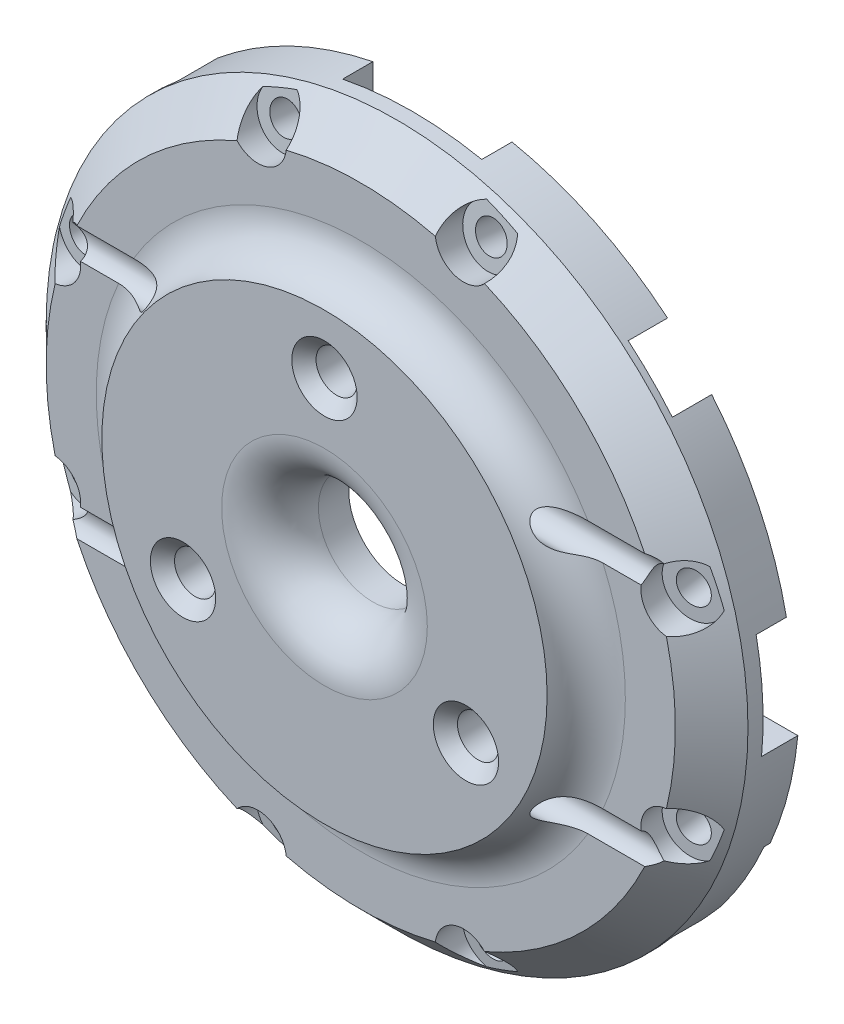
from build123d import *

# Parameters (mm, degrees)
SKETCH1_R               = 29
BOSS_EXTRUDE1_DEPTH     = 6.75
SKETCH3_W               = 44.5
SKETCH3_H               = 44.5
CUT_EXTRUDE1_DEPTH      = 3.25
SKETCH4_R               = 18.4
BOSS_EXTRUDE2_DEPTH     = 3
FILLET1_R               = 3.5
SKETCH5_R               = 1.7
CUT_EXTRUDE2_DEPTH      = 43.155219131
SKETCH7_R               = 3.25
CUT_EXTRUDE3_DEPTH      = 2
CHAMFER2_SIZE           = 3
CUT_EXTRUDE5_DEPTH      = 43.155219131
CUT_EXTRUDE5_DEPTH_BACK = 43.155219131
SKETCH9_R               = 1.3
SKETCH10_W              = 11.5
SKETCH10_H              = 12.03351403
SKETCH10_W_2            = 12.03351403
SKETCH10_H_2            = 11.5
CUT_EXTRUDE6_DEPTH      = 2.5
SKETCH13_W              = 6.5
SKETCH13_H              = 6.5
CUT_EXTRUDE9_DEPTH      = 2.25
SKETCH14_W              = 15.887507813
SKETCH14_H              = 11.6
CUT_EXTRUDE10_DEPTH     = 2.5
FILLET2_R               = 1.5
BOSS_EXTRUDE3_START     = 3
BOSS_EXTRUDE3_DEPTH     = 3
CHAMFER7_SIZE           = 1.25
SKETCH16_R              = 4.5
CUT_EXTRUDE11_DEPTH     = 43.27366215
FILLET3_R               = 4
CHAMFER6_SIZE           = 1
SKETCH17_R              = 1.3
CUT_EXTRUDE12_DEPTH     = 43.155219292
CUT_EXTRUDE13_START     = 20
SKETCH18_R              = 2.35
CUT_EXTRUDE13_DEPTH     = 12.5
CIRPATTERN1_COUNT       = 4


with BuildPart() as part:
    # Sketch1 → Boss-Extrude1 (new body)
    with BuildSketch(Plane.XY):
        Circle(SKETCH1_R)
    extrude(amount=BOSS_EXTRUDE1_DEPTH)

    # Sketch3 → Cut-Extrude1 (cut)
    with BuildSketch(Plane(origin=(0, 0, 0), x_dir=(-1, 0, 0), z_dir=(0, 0, -1))):
        Rectangle(SKETCH3_W, SKETCH3_H)
    extrude(amount=-CUT_EXTRUDE1_DEPTH, mode=Mode.SUBTRACT)

    # Sketch4 → Boss-Extrude2 (add)
    with BuildSketch(Plane.XY.offset(6.75)):
        Circle(SKETCH4_R)
    extrude(amount=BOSS_EXTRUDE2_DEPTH)

    # Fillet1
    # the kernel refuses this fillet: 3.5 mm, written as the material it adds along each edge
    with BuildSketch(Plane(origin=(0, 0, 6.75), x_dir=(1, 0, 0), z_dir=(0, -1, 0))) as fillet1_piece_1:
        with BuildLine():
            CenterArc((21.864101615, 3.5), FILLET1_R, 188.213210702, 81.786789298)
            Line((18.4, 3), (18.330717968, 2.99))
            ThreePointArc((18.330717968, 2.99), (18.33, 1.5), (18.33, 0))
            Line((18.33, 0), (18.4, -0.07))
            Line((18.4, -0.07), (21.864101615, -0.07))
            Line((21.864101615, -0.07), (21.864101615, 0))
        make_face()
    revolve(axis=Axis((0, 0, 6.75), (0, 0, 1)))

    # Sketch5 → Cut-Extrude2 (cut, through all)
    with BuildSketch(Plane.XY.offset(9.75)):
        with Locations((0, 13.5)):
            Circle(SKETCH5_R)
        with Locations((11.691342951, -6.75)):
            Circle(SKETCH5_R)
        with Locations((-11.691342951, -6.75)):
            Circle(SKETCH5_R)
    extrude(amount=-CUT_EXTRUDE2_DEPTH, mode=Mode.SUBTRACT)

    # Sketch7 → Cut-Extrude3 (cut)
    with BuildSketch(Plane(origin=(0, 0, 3.25), x_dir=(-1, 0, 0), z_dir=(0, 0, -1))):
        with Locations((-11.691342951, -6.75)):
            Circle(SKETCH7_R)
        with Locations((11.691342951, -6.75)):
            Circle(SKETCH7_R)
        with Locations((0, 13.5)):
            Circle(SKETCH7_R)
    extrude(amount=-CUT_EXTRUDE3_DEPTH, mode=Mode.SUBTRACT)

    # Chamfer2
    chamfer2_edges = [part.edges().sort_by_distance(p)[0] for p in [
        (-29, 0, 6.75),
    ]]
    chamfer(chamfer2_edges, length=CHAMFER2_SIZE)

    # Sketch9 → Cut-Extrude5 (cut, two sides: drawn at the far end of the back side and taken through both)
    with BuildSketch(Plane(origin=(0, 0, 0), x_dir=(0, 0, -1), z_dir=(1, 0, 0)).offset(-CUT_EXTRUDE5_DEPTH_BACK)):
        with Locations(Location((-7.25, 10, 0), (0, 0, 292.619864948))):
            Circle(SKETCH9_R)
        with Locations(Location((-7.25, -10, 0), (0, 0, 292.619864948))):
            Circle(SKETCH9_R)
    extrude(amount=CUT_EXTRUDE5_DEPTH + CUT_EXTRUDE5_DEPTH_BACK, mode=Mode.SUBTRACT)

    # Sketch10 → Cut-Extrude6 (cut)
    with BuildSketch(Plane(origin=(0, 0, 0), x_dir=(-1, 0, 0), z_dir=(0, 0, -1))):
        with Locations((0, -28.01742408)):
            Rectangle(SKETCH10_W, SKETCH10_H)
        with Locations((28.01742408, 0)):
            Rectangle(SKETCH10_W_2, SKETCH10_H_2)
        with Locations((-28.01742408, 0)):
            Rectangle(SKETCH10_W_2, SKETCH10_H_2)
        with Locations((0, 28.01742408)):
            Rectangle(SKETCH10_W, SKETCH10_H)
    extrude(amount=-CUT_EXTRUDE6_DEPTH, mode=Mode.SUBTRACT)

    # Sketch13 → Cut-Extrude9 (cut)
    with BuildSketch(Plane(origin=(0, 0, 3.25), x_dir=(-1, 0, 0), z_dir=(0, 0, -1))):
        with Locations((-18.9, 11.5)):
            Rectangle(SKETCH13_W, SKETCH13_H)
        with Locations((11.5, 18.9)):
            Rectangle(SKETCH13_W, SKETCH13_H)
        with Locations((18.9, -11.5)):
            Rectangle(SKETCH13_W, SKETCH13_H)
        with Locations((-11.5, -18.9)):
            Rectangle(SKETCH13_W, SKETCH13_H)
    extrude(amount=-CUT_EXTRUDE9_DEPTH, mode=Mode.SUBTRACT)

    # Chamfer5
    # the kernel refuses this chamfer: 1 mm, written as the material it takes off along each edge
    with BuildSketch(Plane(origin=(15.65, 8.25, 3.25), x_dir=(0, -0.9996219169112968, -0.027495876610586487), z_dir=(1, 0, 0)), Plane(origin=(15.65, 14.75, 3.25), x_dir=(-0.9996219169112968, 0, -0.02749587661058651), z_dir=(0, -1, 0)), Plane(origin=(22.15, 14.75, 3.25), x_dir=(0, 0.9996219169112968, -0.02749587661058651), z_dir=(-1, 0, 0)), Plane(origin=(-8.25, 15.65, 3.25), x_dir=(0.9996219169112968, 0, -0.027495876610586487), z_dir=(0, 1, 0)), Plane(origin=(-14.75, 15.65, 3.25), x_dir=(0, -0.9996219169112968, -0.02749587661058651), z_dir=(1, 0, 0)), Plane(origin=(-14.75, 22.15, 3.25), x_dir=(-0.9996219169112968, 0, -0.02749587661058651), z_dir=(0, -1, 0)), Plane(origin=(-15.65, -8.25, 3.25), x_dir=(0, 0.9996219169112968, -0.027495876610586487), z_dir=(-1, 0, 0)), Plane(origin=(-15.65, -14.75, 3.25), x_dir=(0.9996219169112968, 0, -0.02749587661058651), z_dir=(0, 1, 0)), Plane(origin=(-22.15, -14.75, 3.25), x_dir=(0, -0.9996219169112968, -0.02749587661058651), z_dir=(1, 0, 0)), Plane(origin=(8.25, -15.65, 3.25), x_dir=(-0.9996219169112968, 0, -0.027495876610586487), z_dir=(0, -1, 0)), Plane(origin=(14.75, -15.65, 3.25), x_dir=(0, 0.9996219169112968, -0.02749587661058651), z_dir=(-1, 0, 0)), Plane(origin=(14.75, -22.15, 3.25), x_dir=(0.9996219169112968, 0, -0.02749587661058651), z_dir=(0, 1, 0))) as chamfer5_piece_1:
        with BuildLine():
            Line((1.028673195, 0), (-0.056547155, -1.027117794))
            Line((-0.056547155, -1.027117794), (-0.076539593, -1.026567876))
            ThreePointArc((-0.076539593, -1.026567876), (-0.034129227, -0.51339783), (-0.019992438, 0.000549918))
            Line((-0.019992438, 0.000549918), (0.000549918, 0.019992438))
            ThreePointArc((0.000549918, 0.019992438), (0.514497665, 0.00585565), (1.029223113, 0.019992438))
            Line((1.029223113, 0.019992438), (1.028673195, 0))
        make_face()
    extrude(amount=6.5, mode=Mode.SUBTRACT)
    with BuildSketch(Plane(origin=(13.078317012, 8.25, 3.25), x_dir=(0, -0.9996219169112968, -0.027495876610586487), z_dir=(1, 0, 0))) as chamfer5_piece_2a_section:
        with BuildLine():
            Line((1.028673195, 0), (-0.056547155, -1.027117794))
            Line((-0.056547155, -1.027117794), (-0.076539593, -1.026567876))
            ThreePointArc((-0.076539593, -1.026567876), (-0.034129227, -0.51339783), (-0.019992438, 0.000549918))
            Line((-0.019992438, 0.000549918), (0.000549918, 0.019992438))
            ThreePointArc((0.000549918, 0.019992438), (0.514497665, 0.00585565), (1.029223113, 0.019992438))
            Line((1.029223113, 0.019992438), (1.028673195, 0))
        make_face()
    chamfer5_piece_2a = extrude(amount=9.071682988, mode=Mode.PRIVATE)
    chamfer5_piece_2a = split(chamfer5_piece_2a, bisect_by=Plane(origin=(15.65, 7.920206373, 3.579793627), z_dir=(-1, 0, 0)), keep=Keep.TOP, mode=Mode.PRIVATE)
    with BuildSketch(Plane(origin=(15.65, 14.75, 3.25), x_dir=(-0.9996219169112968, 0, -0.02749587661058651), z_dir=(0, -1, 0))) as chamfer5_piece_2b_section:
        with BuildLine():
            Line((1.028673195, 0), (-0.056547155, -1.027117794))
            Line((-0.056547155, -1.027117794), (-0.076539593, -1.026567876))
            ThreePointArc((-0.076539593, -1.026567876), (-0.034129227, -0.51339783), (-0.019992438, 0.000549918))
            Line((-0.019992438, 0.000549918), (0.000549918, 0.019992438))
            ThreePointArc((0.000549918, 0.019992438), (0.514497665, 0.00585565), (1.029223113, 0.019992438))
            Line((1.029223113, 0.019992438), (1.028673195, 0))
        make_face()
    chamfer5_piece_2b = extrude(amount=9.071682988, mode=Mode.PRIVATE)
    chamfer5_piece_2b = split(chamfer5_piece_2b, bisect_by=Plane(origin=(15.320206373, 8.25, 3.579793627), z_dir=(0, -1, 0)), keep=Keep.TOP, mode=Mode.PRIVATE)
    chamfer5_piece_2 = chamfer5_piece_2a & chamfer5_piece_2b
    add(chamfer5_piece_2, mode=Mode.SUBTRACT)
    with BuildSketch(Plane(origin=(15.65, 17.321682988, 3.25), x_dir=(-0.9996219169112968, 0, -0.02749587661058651), z_dir=(0, -1, 0))) as chamfer5_piece_3a_section:
        with BuildLine():
            Line((1.028673195, 0), (-0.056547155, -1.027117794))
            Line((-0.056547155, -1.027117794), (-0.076539593, -1.026567876))
            ThreePointArc((-0.076539593, -1.026567876), (-0.034129227, -0.51339783), (-0.019992438, 0.000549918))
            Line((-0.019992438, 0.000549918), (0.000549918, 0.019992438))
            ThreePointArc((0.000549918, 0.019992438), (0.514497665, 0.00585565), (1.029223113, 0.019992438))
            Line((1.029223113, 0.019992438), (1.028673195, 0))
        make_face()
    chamfer5_piece_3a = extrude(amount=9.071682988, mode=Mode.PRIVATE)
    chamfer5_piece_3a = split(chamfer5_piece_3a, bisect_by=Plane(origin=(15.320206373, 14.75, 3.579793627), z_dir=(0, 1, 0)), keep=Keep.TOP, mode=Mode.PRIVATE)
    with BuildSketch(Plane(origin=(22.15, 14.75, 3.25), x_dir=(0, 0.9996219169112968, -0.02749587661058651), z_dir=(-1, 0, 0))) as chamfer5_piece_3b_section:
        with BuildLine():
            Line((1.028673195, 0), (-0.056547155, -1.027117794))
            Line((-0.056547155, -1.027117794), (-0.076539593, -1.026567876))
            ThreePointArc((-0.076539593, -1.026567876), (-0.034129227, -0.51339783), (-0.019992438, 0.000549918))
            Line((-0.019992438, 0.000549918), (0.000549918, 0.019992438))
            ThreePointArc((0.000549918, 0.019992438), (0.514497665, 0.00585565), (1.029223113, 0.019992438))
            Line((1.029223113, 0.019992438), (1.028673195, 0))
        make_face()
    chamfer5_piece_3b = extrude(amount=9.071682988, mode=Mode.PRIVATE)
    chamfer5_piece_3b = split(chamfer5_piece_3b, bisect_by=Plane(origin=(15.65, 15.079793627, 3.579793627), z_dir=(-1, 0, 0)), keep=Keep.TOP, mode=Mode.PRIVATE)
    chamfer5_piece_3 = chamfer5_piece_3a & chamfer5_piece_3b
    add(chamfer5_piece_3, mode=Mode.SUBTRACT)
    with BuildSketch(Plane(origin=(-8.25, 13.078317012, 3.25), x_dir=(0.9996219169112968, 0, -0.027495876610586487), z_dir=(0, 1, 0))) as chamfer5_piece_4a_section:
        with BuildLine():
            Line((1.028673195, 0), (-0.056547155, -1.027117794))
            Line((-0.056547155, -1.027117794), (-0.076539593, -1.026567876))
            ThreePointArc((-0.076539593, -1.026567876), (-0.034129227, -0.51339783), (-0.019992438, 0.000549918))
            Line((-0.019992438, 0.000549918), (0.000549918, 0.019992438))
            ThreePointArc((0.000549918, 0.019992438), (0.514497665, 0.00585565), (1.029223113, 0.019992438))
            Line((1.029223113, 0.019992438), (1.028673195, 0))
        make_face()
    chamfer5_piece_4a = extrude(amount=9.071682988, mode=Mode.PRIVATE)
    chamfer5_piece_4a = split(chamfer5_piece_4a, bisect_by=Plane(origin=(-7.920206373, 15.65, 3.579793627), z_dir=(0, -1, 0)), keep=Keep.TOP, mode=Mode.PRIVATE)
    with BuildSketch(Plane(origin=(-14.75, 15.65, 3.25), x_dir=(0, -0.9996219169112968, -0.02749587661058651), z_dir=(1, 0, 0))) as chamfer5_piece_4b_section:
        with BuildLine():
            Line((1.028673195, 0), (-0.056547155, -1.027117794))
            Line((-0.056547155, -1.027117794), (-0.076539593, -1.026567876))
            ThreePointArc((-0.076539593, -1.026567876), (-0.034129227, -0.51339783), (-0.019992438, 0.000549918))
            Line((-0.019992438, 0.000549918), (0.000549918, 0.019992438))
            ThreePointArc((0.000549918, 0.019992438), (0.514497665, 0.00585565), (1.029223113, 0.019992438))
            Line((1.029223113, 0.019992438), (1.028673195, 0))
        make_face()
    chamfer5_piece_4b = extrude(amount=9.071682988, mode=Mode.PRIVATE)
    chamfer5_piece_4b = split(chamfer5_piece_4b, bisect_by=Plane(origin=(-8.25, 15.320206373, 3.579793627), z_dir=(1, 0, 0)), keep=Keep.TOP, mode=Mode.PRIVATE)
    chamfer5_piece_4 = chamfer5_piece_4a & chamfer5_piece_4b
    add(chamfer5_piece_4, mode=Mode.SUBTRACT)
    with BuildSketch(Plane(origin=(-17.321682988, 15.65, 3.25), x_dir=(0, -0.9996219169112968, -0.02749587661058651), z_dir=(1, 0, 0))) as chamfer5_piece_5a_section:
        with BuildLine():
            Line((1.028673195, 0), (-0.056547155, -1.027117794))
            Line((-0.056547155, -1.027117794), (-0.076539593, -1.026567876))
            ThreePointArc((-0.076539593, -1.026567876), (-0.034129227, -0.51339783), (-0.019992438, 0.000549918))
            Line((-0.019992438, 0.000549918), (0.000549918, 0.019992438))
            ThreePointArc((0.000549918, 0.019992438), (0.514497665, 0.00585565), (1.029223113, 0.019992438))
            Line((1.029223113, 0.019992438), (1.028673195, 0))
        make_face()
    chamfer5_piece_5a = extrude(amount=9.071682988, mode=Mode.PRIVATE)
    chamfer5_piece_5a = split(chamfer5_piece_5a, bisect_by=Plane(origin=(-14.75, 15.320206373, 3.579793627), z_dir=(-1, 0, 0)), keep=Keep.TOP, mode=Mode.PRIVATE)
    with BuildSketch(Plane(origin=(-14.75, 22.15, 3.25), x_dir=(-0.9996219169112968, 0, -0.02749587661058651), z_dir=(0, -1, 0))) as chamfer5_piece_5b_section:
        with BuildLine():
            Line((1.028673195, 0), (-0.056547155, -1.027117794))
            Line((-0.056547155, -1.027117794), (-0.076539593, -1.026567876))
            ThreePointArc((-0.076539593, -1.026567876), (-0.034129227, -0.51339783), (-0.019992438, 0.000549918))
            Line((-0.019992438, 0.000549918), (0.000549918, 0.019992438))
            ThreePointArc((0.000549918, 0.019992438), (0.514497665, 0.00585565), (1.029223113, 0.019992438))
            Line((1.029223113, 0.019992438), (1.028673195, 0))
        make_face()
    chamfer5_piece_5b = extrude(amount=9.071682988, mode=Mode.PRIVATE)
    chamfer5_piece_5b = split(chamfer5_piece_5b, bisect_by=Plane(origin=(-15.079793627, 15.65, 3.579793627), z_dir=(0, -1, 0)), keep=Keep.TOP, mode=Mode.PRIVATE)
    chamfer5_piece_5 = chamfer5_piece_5a & chamfer5_piece_5b
    add(chamfer5_piece_5, mode=Mode.SUBTRACT)
    with BuildSketch(Plane(origin=(-13.078317012, -8.25, 3.25), x_dir=(0, 0.9996219169112968, -0.027495876610586487), z_dir=(-1, 0, 0))) as chamfer5_piece_6a_section:
        with BuildLine():
            Line((1.028673195, 0), (-0.056547155, -1.027117794))
            Line((-0.056547155, -1.027117794), (-0.076539593, -1.026567876))
            ThreePointArc((-0.076539593, -1.026567876), (-0.034129227, -0.51339783), (-0.019992438, 0.000549918))
            Line((-0.019992438, 0.000549918), (0.000549918, 0.019992438))
            ThreePointArc((0.000549918, 0.019992438), (0.514497665, 0.00585565), (1.029223113, 0.019992438))
            Line((1.029223113, 0.019992438), (1.028673195, 0))
        make_face()
    chamfer5_piece_6a = extrude(amount=9.071682988, mode=Mode.PRIVATE)
    chamfer5_piece_6a = split(chamfer5_piece_6a, bisect_by=Plane(origin=(-15.65, -7.920206373, 3.579793627), z_dir=(1, 0, 0)), keep=Keep.TOP, mode=Mode.PRIVATE)
    with BuildSketch(Plane(origin=(-15.65, -14.75, 3.25), x_dir=(0.9996219169112968, 0, -0.02749587661058651), z_dir=(0, 1, 0))) as chamfer5_piece_6b_section:
        with BuildLine():
            Line((1.028673195, 0), (-0.056547155, -1.027117794))
            Line((-0.056547155, -1.027117794), (-0.076539593, -1.026567876))
            ThreePointArc((-0.076539593, -1.026567876), (-0.034129227, -0.51339783), (-0.019992438, 0.000549918))
            Line((-0.019992438, 0.000549918), (0.000549918, 0.019992438))
            ThreePointArc((0.000549918, 0.019992438), (0.514497665, 0.00585565), (1.029223113, 0.019992438))
            Line((1.029223113, 0.019992438), (1.028673195, 0))
        make_face()
    chamfer5_piece_6b = extrude(amount=9.071682988, mode=Mode.PRIVATE)
    chamfer5_piece_6b = split(chamfer5_piece_6b, bisect_by=Plane(origin=(-15.320206373, -8.25, 3.579793627), z_dir=(0, 1, 0)), keep=Keep.TOP, mode=Mode.PRIVATE)
    chamfer5_piece_6 = chamfer5_piece_6a & chamfer5_piece_6b
    add(chamfer5_piece_6, mode=Mode.SUBTRACT)
    with BuildSketch(Plane(origin=(-15.65, -17.321682988, 3.25), x_dir=(0.9996219169112968, 0, -0.02749587661058651), z_dir=(0, 1, 0))) as chamfer5_piece_7a_section:
        with BuildLine():
            Line((1.028673195, 0), (-0.056547155, -1.027117794))
            Line((-0.056547155, -1.027117794), (-0.076539593, -1.026567876))
            ThreePointArc((-0.076539593, -1.026567876), (-0.034129227, -0.51339783), (-0.019992438, 0.000549918))
            Line((-0.019992438, 0.000549918), (0.000549918, 0.019992438))
            ThreePointArc((0.000549918, 0.019992438), (0.514497665, 0.00585565), (1.029223113, 0.019992438))
            Line((1.029223113, 0.019992438), (1.028673195, 0))
        make_face()
    chamfer5_piece_7a = extrude(amount=9.071682988, mode=Mode.PRIVATE)
    chamfer5_piece_7a = split(chamfer5_piece_7a, bisect_by=Plane(origin=(-15.320206373, -14.75, 3.579793627), z_dir=(0, -1, 0)), keep=Keep.TOP, mode=Mode.PRIVATE)
    with BuildSketch(Plane(origin=(-22.15, -14.75, 3.25), x_dir=(0, -0.9996219169112968, -0.02749587661058651), z_dir=(1, 0, 0))) as chamfer5_piece_7b_section:
        with BuildLine():
            Line((1.028673195, 0), (-0.056547155, -1.027117794))
            Line((-0.056547155, -1.027117794), (-0.076539593, -1.026567876))
            ThreePointArc((-0.076539593, -1.026567876), (-0.034129227, -0.51339783), (-0.019992438, 0.000549918))
            Line((-0.019992438, 0.000549918), (0.000549918, 0.019992438))
            ThreePointArc((0.000549918, 0.019992438), (0.514497665, 0.00585565), (1.029223113, 0.019992438))
            Line((1.029223113, 0.019992438), (1.028673195, 0))
        make_face()
    chamfer5_piece_7b = extrude(amount=9.071682988, mode=Mode.PRIVATE)
    chamfer5_piece_7b = split(chamfer5_piece_7b, bisect_by=Plane(origin=(-15.65, -15.079793627, 3.579793627), z_dir=(1, 0, 0)), keep=Keep.TOP, mode=Mode.PRIVATE)
    chamfer5_piece_7 = chamfer5_piece_7a & chamfer5_piece_7b
    add(chamfer5_piece_7, mode=Mode.SUBTRACT)
    with BuildSketch(Plane(origin=(8.25, -13.078317012, 3.25), x_dir=(-0.9996219169112968, 0, -0.027495876610586487), z_dir=(0, -1, 0))) as chamfer5_piece_8a_section:
        with BuildLine():
            Line((1.028673195, 0), (-0.056547155, -1.027117794))
            Line((-0.056547155, -1.027117794), (-0.076539593, -1.026567876))
            ThreePointArc((-0.076539593, -1.026567876), (-0.034129227, -0.51339783), (-0.019992438, 0.000549918))
            Line((-0.019992438, 0.000549918), (0.000549918, 0.019992438))
            ThreePointArc((0.000549918, 0.019992438), (0.514497665, 0.00585565), (1.029223113, 0.019992438))
            Line((1.029223113, 0.019992438), (1.028673195, 0))
        make_face()
    chamfer5_piece_8a = extrude(amount=9.071682988, mode=Mode.PRIVATE)
    chamfer5_piece_8a = split(chamfer5_piece_8a, bisect_by=Plane(origin=(7.920206373, -15.65, 3.579793627), z_dir=(0, 1, 0)), keep=Keep.TOP, mode=Mode.PRIVATE)
    with BuildSketch(Plane(origin=(14.75, -15.65, 3.25), x_dir=(0, 0.9996219169112968, -0.02749587661058651), z_dir=(-1, 0, 0))) as chamfer5_piece_8b_section:
        with BuildLine():
            Line((1.028673195, 0), (-0.056547155, -1.027117794))
            Line((-0.056547155, -1.027117794), (-0.076539593, -1.026567876))
            ThreePointArc((-0.076539593, -1.026567876), (-0.034129227, -0.51339783), (-0.019992438, 0.000549918))
            Line((-0.019992438, 0.000549918), (0.000549918, 0.019992438))
            ThreePointArc((0.000549918, 0.019992438), (0.514497665, 0.00585565), (1.029223113, 0.019992438))
            Line((1.029223113, 0.019992438), (1.028673195, 0))
        make_face()
    chamfer5_piece_8b = extrude(amount=9.071682988, mode=Mode.PRIVATE)
    chamfer5_piece_8b = split(chamfer5_piece_8b, bisect_by=Plane(origin=(8.25, -15.320206373, 3.579793627), z_dir=(-1, 0, 0)), keep=Keep.TOP, mode=Mode.PRIVATE)
    chamfer5_piece_8 = chamfer5_piece_8a & chamfer5_piece_8b
    add(chamfer5_piece_8, mode=Mode.SUBTRACT)
    with BuildSketch(Plane(origin=(17.321682988, -15.65, 3.25), x_dir=(0, 0.9996219169112968, -0.02749587661058651), z_dir=(-1, 0, 0))) as chamfer5_piece_9a_section:
        with BuildLine():
            Line((1.028673195, 0), (-0.056547155, -1.027117794))
            Line((-0.056547155, -1.027117794), (-0.076539593, -1.026567876))
            ThreePointArc((-0.076539593, -1.026567876), (-0.034129227, -0.51339783), (-0.019992438, 0.000549918))
            Line((-0.019992438, 0.000549918), (0.000549918, 0.019992438))
            ThreePointArc((0.000549918, 0.019992438), (0.514497665, 0.00585565), (1.029223113, 0.019992438))
            Line((1.029223113, 0.019992438), (1.028673195, 0))
        make_face()
    chamfer5_piece_9a = extrude(amount=9.071682988, mode=Mode.PRIVATE)
    chamfer5_piece_9a = split(chamfer5_piece_9a, bisect_by=Plane(origin=(14.75, -15.320206373, 3.579793627), z_dir=(1, 0, 0)), keep=Keep.TOP, mode=Mode.PRIVATE)
    with BuildSketch(Plane(origin=(14.75, -22.15, 3.25), x_dir=(0.9996219169112968, 0, -0.02749587661058651), z_dir=(0, 1, 0))) as chamfer5_piece_9b_section:
        with BuildLine():
            Line((1.028673195, 0), (-0.056547155, -1.027117794))
            Line((-0.056547155, -1.027117794), (-0.076539593, -1.026567876))
            ThreePointArc((-0.076539593, -1.026567876), (-0.034129227, -0.51339783), (-0.019992438, 0.000549918))
            Line((-0.019992438, 0.000549918), (0.000549918, 0.019992438))
            ThreePointArc((0.000549918, 0.019992438), (0.514497665, 0.00585565), (1.029223113, 0.019992438))
            Line((1.029223113, 0.019992438), (1.028673195, 0))
        make_face()
    chamfer5_piece_9b = extrude(amount=9.071682988, mode=Mode.PRIVATE)
    chamfer5_piece_9b = split(chamfer5_piece_9b, bisect_by=Plane(origin=(15.079793627, -15.65, 3.579793627), z_dir=(0, 1, 0)), keep=Keep.TOP, mode=Mode.PRIVATE)
    chamfer5_piece_9 = chamfer5_piece_9a & chamfer5_piece_9b
    add(chamfer5_piece_9, mode=Mode.SUBTRACT)

    # Sketch14 → Cut-Extrude10 (cut)
    with BuildSketch(Plane(origin=(0, 0, 0), x_dir=(-1, 0, 0), z_dir=(0, 0, -1))):
        with Locations((-27.176000206, -5.8)):
            Rectangle(SKETCH14_W, SKETCH14_H)
    extrude(amount=-CUT_EXTRUDE10_DEPTH, mode=Mode.SUBTRACT)

    # Fillet2
    # the kernel refuses this fillet: 1.5 mm, written as the material it takes off along each edge
    with BuildSketch(Plane(origin=(-11.691342951, -6.75, 3.25), x_dir=(-1, 0, 0), z_dir=(0, -1, 0))) as fillet2_piece_1:
        with BuildLine():
            CenterArc((3.25 + FILLET2_R, -FILLET2_R), FILLET2_R, 90, 90)
            Line((3.25, -FILLET2_R), (3.25, 0))
            Line((3.25, 0), (3.25 + FILLET2_R, 0))
        make_face()
    revolve(axis=Axis((-11.691342951, -6.75, 3.25), (0, 0, -1)), revolution_arc=359.64, mode=Mode.SUBTRACT)
    with BuildSketch(Plane(origin=(11.691342951, -6.75, 3.25), x_dir=(-1, 0, 0), z_dir=(0, -1, 0))) as fillet2_piece_2:
        with BuildLine():
            CenterArc((3.25 + FILLET2_R, -FILLET2_R), FILLET2_R, 90, 90)
            Line((3.25, -FILLET2_R), (3.25, 0))
            Line((3.25, 0), (3.25 + FILLET2_R, 0))
        make_face()
    revolve(axis=Axis((11.691342951, -6.75, 3.25), (0, 0, -1)), mode=Mode.SUBTRACT)
    with BuildSketch(Plane(origin=(0, 13.5, 3.25), x_dir=(-1, 0, 0), z_dir=(0, -1, 0))) as fillet2_piece_3:
        with BuildLine():
            CenterArc((3.25 + FILLET2_R, -FILLET2_R), FILLET2_R, 90, 90)
            Line((3.25 + FILLET2_R, 0), (3.25, 0))
            Line((3.25, 0), (3.25, -FILLET2_R))
        make_face()
    revolve(axis=Axis((0, 13.5, 3.25), (0, 0, -1)), mode=Mode.SUBTRACT)
    with BuildSketch(Plane(origin=(-11.691342951, -6.75, 3.25), x_dir=(-0.2594822912336791, -0.9657478659236686, 0), z_dir=(0.9657478659236686, -0.2594822912336791, 0))) as fillet2_piece_4:
        with BuildLine():
            CenterArc((3.25 + FILLET2_R, -FILLET2_R), FILLET2_R, 90, 90)
            Line((3.25, -FILLET2_R), (3.25, 0))
            Line((3.25, 0), (3.25 + FILLET2_R, 0))
        make_face()
    revolve(axis=Axis((-11.691342951, -6.75, 3.25), (0, 0, -1)), revolution_arc=74.960654636, mode=Mode.SUBTRACT)

    # Sketch19 → Boss-Extrude3 (add)
    with BuildSketch(Plane(origin=(0, 0, 2.5), x_dir=(-1, 0, 0), z_dir=(0, 0, -1)).offset(BOSS_EXTRUDE3_START)):
        with BuildLine():
            Line((-22.25, -2.75), (-22.25, -11.6))
            Line((-22.25, -11.6), (-26.578939031, -11.6))
            ThreePointArc((-26.578939031, -11.6), (-28.07504081, -7.265816095), (-28.869317623, -2.75))
            Line((-28.869317623, -2.75), (-22.25, -2.75))
        make_face()
    extrude(amount=-BOSS_EXTRUDE3_DEPTH)

    # Chamfer7
    chamfer7_edges = [part.edges().sort_by_distance(p)[0] for p in [
        (22.25, -7.175, -0.5),
    ]]
    chamfer(chamfer7_edges, length=CHAMFER7_SIZE)

    # Sketch16 → Cut-Extrude11 (cut, through all)
    with BuildSketch(Plane.XY.offset(9.75)):
        Circle(SKETCH16_R)
    extrude(amount=-CUT_EXTRUDE11_DEPTH, mode=Mode.SUBTRACT)

    # Fillet3
    fillet3_edges = [part.edges().sort_by_distance(p)[0] for p in [
        (-4.5, 0, 9.75),
    ]]
    fillet(fillet3_edges, radius=FILLET3_R)

    # Chamfer6
    chamfer6_edges = [part.edges().sort_by_distance(p)[0] for p in [
        (9.991342951, -6.75, 9.75),
        (-1.7, 13.5, 9.75),
        (-13.391342951, -6.75, 9.75),
    ]]
    chamfer(chamfer6_edges, length=CHAMFER6_SIZE)

    # Sketch17 → Cut-Extrude12 (cut, through all)
    with BuildSketch(Plane(origin=(0, 0, 0), x_dir=(0, -1, 0), z_dir=(0.1218693434051474, 0, 0.9925461516413221))):
        with Locations(Location((-8.5, 24.5, 0), (0, 0, 270))):
            Circle(SKETCH17_R)
        with Locations(Location((8.5, 24.5, 0), (0, 0, 283.342346869))):
            Circle(SKETCH17_R)
    cut_extrude12 = extrude(amount=CUT_EXTRUDE12_DEPTH, mode=Mode.SUBTRACT)

    # Sketch18 → Cut-Extrude13 (cut)
    with BuildSketch(Plane(origin=(0, 0, 0), x_dir=(0, -1, 0), z_dir=(0.1218693434051474, 0, 0.9925461516413221)).offset(CUT_EXTRUDE13_START)):
        with Locations((-8.5, 24.5)):
            Circle(SKETCH18_R)
        with Locations((8.5, 24.5)):
            Circle(SKETCH18_R)
    cut_extrude13 = extrude(amount=-CUT_EXTRUDE13_DEPTH, mode=Mode.SUBTRACT)

    # CirPattern1: Cut-Extrude12, Cut-Extrude13 ×4 about axis
    cirpattern1_axis = Axis((0, 0, 0), (0, 0, 1))
    add([cut_extrude12.rotate(cirpattern1_axis, i * 360 / CIRPATTERN1_COUNT) for i in range(1, CIRPATTERN1_COUNT)], mode=Mode.SUBTRACT)
    add([cut_extrude13.rotate(cirpattern1_axis, i * 360 / CIRPATTERN1_COUNT) for i in range(1, CIRPATTERN1_COUNT)], mode=Mode.SUBTRACT)


solid = part.part
